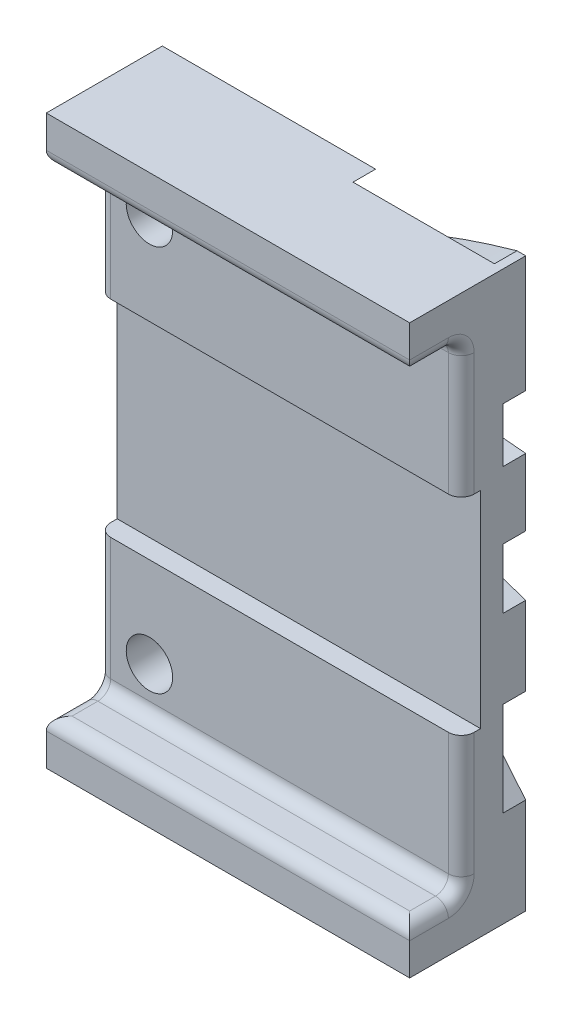
from build123d import *

# Parameters (mm, degrees)
BOSS_EXTRUDE1_DEPTH      = 11
BOSS_EXTRUDE1_DEPTH_BACK = 2
SKETCH1_W                = 28.18
SKETCH1_H                = 44
CUT_EXTRUDE1_DEPTH       = 37
SKETCH4_W                = 20.18
SKETCH4_H                = 4
CUT_EXTRUDE2_DEPTH       = 48
CUT_EXTRUDE3_DEPTH       = 1.75
SKETCH7_R                = 1.8
CUT_EXTRUDE4_DEPTH       = 23
SKETCH8_R                = 3.25
CUT_EXTRUDE5_DEPTH       = 1.75
SKETCH10_W               = 11.795844225
SKETCH10_H               = 4.586005201
CUT_EXTRUDE7_DEPTH       = 53
FILLET1_R                = 1


with BuildPart() as part:
    # Sketch1 → Boss-Extrude1 (new, two sides: drawn at the far end of the back side and taken through both)
    with BuildSketch(Plane.XY.offset(-BOSS_EXTRUDE1_DEPTH_BACK)):
        Rectangle(SKETCH1_W, SKETCH1_H)
    extrude(amount=BOSS_EXTRUDE1_DEPTH + BOSS_EXTRUDE1_DEPTH_BACK)

    # Sketch3 → Cut-Extrude1 (cut)
    with BuildSketch(Plane.ZY.offset(14.09)):
        Polygon((8, 8), (11, 8), (11, -8), (8, -8), (8, -18.5), (3, -18.5), (3, -8), (1.5033938, -8), (1.5033938, 8), (3, 8), (3, 18.5), (8, 18.5), align=None)
    extrude(amount=-CUT_EXTRUDE1_DEPTH, mode=Mode.SUBTRACT)

    # Sketch4 → Cut-Extrude2 (cut)
    with BuildSketch(Plane.XZ.offset(22)):
        with Locations((4, 9)):
            Rectangle(SKETCH4_W, SKETCH4_H)
    extrude(amount=-CUT_EXTRUDE2_DEPTH, mode=Mode.SUBTRACT)

    # Sketch5 → Cut-Extrude3 (cut)
    with BuildSketch(Plane(origin=(0, 0, -2), x_dir=(-1, 0, 0), z_dir=(0, 0, -1))):
        with BuildLine():
            add(Edge.make_bspline(
                [(-2.448223174, 22), (19.56705897, 11.536361781), (5.151599528, -7.62224079), (5.592236917, -22)],
                knots=[0, 0, 0, 0, 0.832841206, 0.832841206, 0.832841206, 0.832841206], degree=3))
            Line((-2.448223174, 22), (-13.413117725, 22))
            add(Edge.make_bspline(
                [(-13.413117725, 22), (18.496116363, 13.047461166), (3.546154763, -4.863207343), (0.001206333, -22)],
                knots=[0, 0, 0, 0, 0.886771983, 0.886771983, 0.886771983, 0.886771983], degree=3))
            Line((0.001206333, -22), (5.592236917, -22))
        make_face()
        with BuildLine():
            Line((-9.422350513, -22), (-5.513274624, -22))
            add(Edge.make_bspline(
                [(-14.09, 12.943541527), (17.027152303, 14.230895657), (-0.913223026, -5.637747584), (-5.513274624, -22)],
                knots=[0, 0, 0, 0, 0.88215351, 0.88215351, 0.88215351, 0.88215351], degree=3))
            Line((-14.09, 12.943541527), (-14.09, 8.727219843))
            add(Edge.make_bspline(
                [(-14.09, 8.727219843), (12.710361443, 11.678555955), (-5.250487577, -7.026945605), (-9.422350513, -22)],
                knots=[0, 0, 0, 0, 0.871233208, 0.871233208, 0.871233208, 0.871233208], degree=3))
        make_face()
        with BuildLine():
            add(Edge.make_bspline(
                [(-14.09, 3.523280295), (7.913446573, 11.6376574), (-14.09, -14.545652593)],
                knots=[0, 0, 0, 1, 1, 1], degree=2))
            Line((-14.09, 3.523280295), (-14.09, -1.131328535))
            add(Edge.make_bspline(
                [(-14.09, -1.131328535), (-1.654052468, 3.211926994), (-14.09, -7.240502624)],
                knots=[0, 0, 0, 1, 1, 1], degree=2))
            Line((-14.09, -7.240502624), (-14.09, -14.545652593))
        make_face()
    extrude(amount=-CUT_EXTRUDE3_DEPTH, mode=Mode.SUBTRACT)

    # Sketch7 → Cut-Extrude4 (cut)
    with BuildSketch(Plane.XY.offset(11)):
        with Locations((-10.09, 15)):
            Circle(SKETCH7_R)
        with Locations((-10.09, -15)):
            Circle(SKETCH7_R)
    extrude(amount=-CUT_EXTRUDE4_DEPTH, mode=Mode.SUBTRACT)

    # Sketch8 → Cut-Extrude5 (cut)
    with BuildSketch(Plane(origin=(0, 0, -2), x_dir=(-1, 0, 0), z_dir=(0, 0, -1))):
        with Locations((10.09, -15)):
            Circle(SKETCH8_R)
        with Locations((10.09, 15)):
            Circle(SKETCH8_R)
    extrude(amount=-CUT_EXTRUDE5_DEPTH, mode=Mode.SUBTRACT)

    # Sketch10 → Cut-Extrude7 (cut)
    with BuildSketch(Plane(origin=(0, 22, 0), x_dir=(1, 0, 0), z_dir=(0, 1, 0))):
        with Locations((-10.712086776, -9.2930026)):
            Rectangle(SKETCH10_W, SKETCH10_H)
    extrude(amount=-CUT_EXTRUDE7_DEPTH, mode=Mode.SUBTRACT)

    # Fillet1
    fillet1_edges = [part.edges().sort_by_distance(p)[0] for p in [
        (-14.09, -13.25, 3),
        (14.09, -13.25, 3),
        (14.09, 13.25, 3),
        (-14.09, 13.25, 3),
        (-14.09, -18.5, 5),
        (0, -18.5, 3),
        (14.09, -18.5, 5),
        (0, -18.5, 7),
        (14.09, 18.5, 5),
        (0, 18.5, 3),
        (-14.09, 18.5, 5),
        (0, 18.5, 7),
    ]]
    fillet(fillet1_edges, radius=FILLET1_R)


solid = part.part
